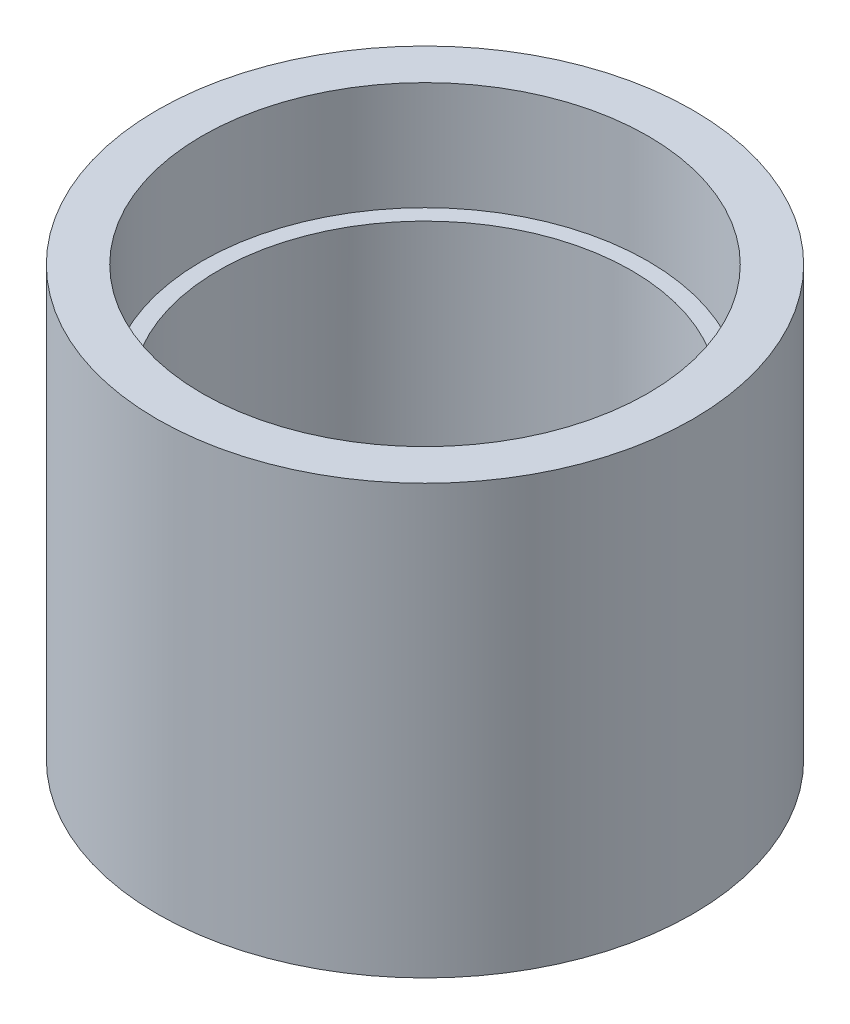
from build123d import *

# Parameters (mm, degrees)
SKETCH1_R           = 22.225
BOSS_EXTRUDE1_DEPTH = 35.56
SKETCH2_R           = 18.5039
CUT_EXTRUDE1_DEPTH  = 8.9916
CUT_EXTRUDE2_START  = -8.9916
SKETCH4_R           = 18.5039
CUT_EXTRUDE2_DEPTH  = 8.9916
SKETCH5_R           = 17.145
CUT_EXTRUDE3_DEPTH  = 42.155572266


with BuildPart() as part:
    # Sketch1 → Boss-Extrude1 (new body)
    with BuildSketch(Plane(origin=(0, 0, 0), x_dir=(1, 0, 0), z_dir=(0, 1, 0))):
        Circle(SKETCH1_R)
    extrude(amount=BOSS_EXTRUDE1_DEPTH)

    # Sketch2 → Cut-Extrude1 (cut)
    with BuildSketch(Plane(origin=(0, 35.56, 0), x_dir=(1, 0, 0), z_dir=(0, 1, 0))):
        Circle(SKETCH2_R)
    extrude(amount=-CUT_EXTRUDE1_DEPTH, mode=Mode.SUBTRACT)

    # Sketch4 → Cut-Extrude2 (cut)
    with BuildSketch(Plane.XZ.offset(CUT_EXTRUDE2_START)):
        Circle(SKETCH4_R)
    extrude(amount=CUT_EXTRUDE2_DEPTH, mode=Mode.SUBTRACT)

    # Sketch5 → Cut-Extrude3 (cut, through all)
    with BuildSketch(Plane.XZ.offset(-8.9916)):
        Circle(SKETCH5_R)
    extrude(amount=-CUT_EXTRUDE3_DEPTH, mode=Mode.SUBTRACT)


solid = part.part
